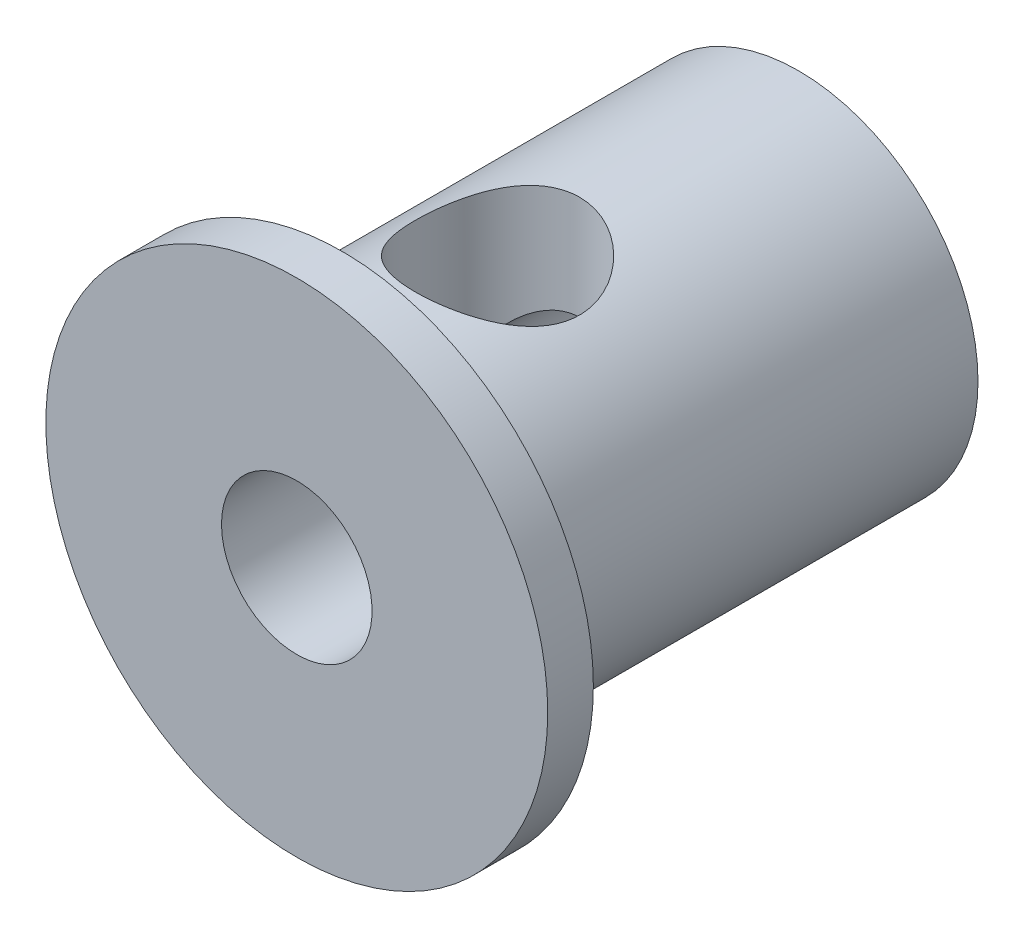
from build123d import *

# Parameters (mm, degrees)
SKETCH2_R           = 4.9911
SKETCH2_R_2         = 2.0955
BOSS_EXTRUDE1_DEPTH = 12.7
SKETCH3_R           = 2.286
CUT_EXTRUDE1_DEPTH  = 12.7
SKETCH4_W           = 1.27
SKETCH4_H           = 6.985
FILLET1_R           = 0.381
SKETCH5_R           = 2.0955
CUT_EXTRUDE2_DEPTH  = 17.089451592


with BuildPart() as part:
    # Sketch2 → Boss-Extrude1 (new body)
    with BuildSketch(Plane.XY):
        Circle(SKETCH2_R)
        Circle(SKETCH2_R_2, mode=Mode.SUBTRACT)
    extrude(amount=BOSS_EXTRUDE1_DEPTH)

    # Sketch3 → Cut-Extrude1 (cut, symmetric)
    with BuildSketch(Plane.XZ):
        with Locations((0, 8.382)):
            Circle(SKETCH3_R)
    extrude(amount=CUT_EXTRUDE1_DEPTH, both=True, mode=Mode.SUBTRACT)

    # Sketch4 → Revolve1 (revolve)
    with BuildSketch(Plane(origin=(0, 0, 0), x_dir=(0, 0, -1), z_dir=(1, 0, 0))):
        with Locations((-13.335, 3.4925)):
            Rectangle(SKETCH4_W, SKETCH4_H)
    revolve(axis=Axis((0, 0, 0), (0, 0, -1)))

    # Fillet1
    fillet1_edges = [part.edges().sort_by_distance(p)[0] for p in [
        (-4.9911, 0, 12.7),
    ]]
    fillet(fillet1_edges, radius=FILLET1_R)

    # Sketch5 → Cut-Extrude2 (cut, through all)
    with BuildSketch(Plane(origin=(0, 0, 12.7), x_dir=(-1, 0, 0), z_dir=(0, 0, -1))):
        Circle(SKETCH5_R)
    extrude(amount=-CUT_EXTRUDE2_DEPTH, mode=Mode.SUBTRACT)


solid = part.part
